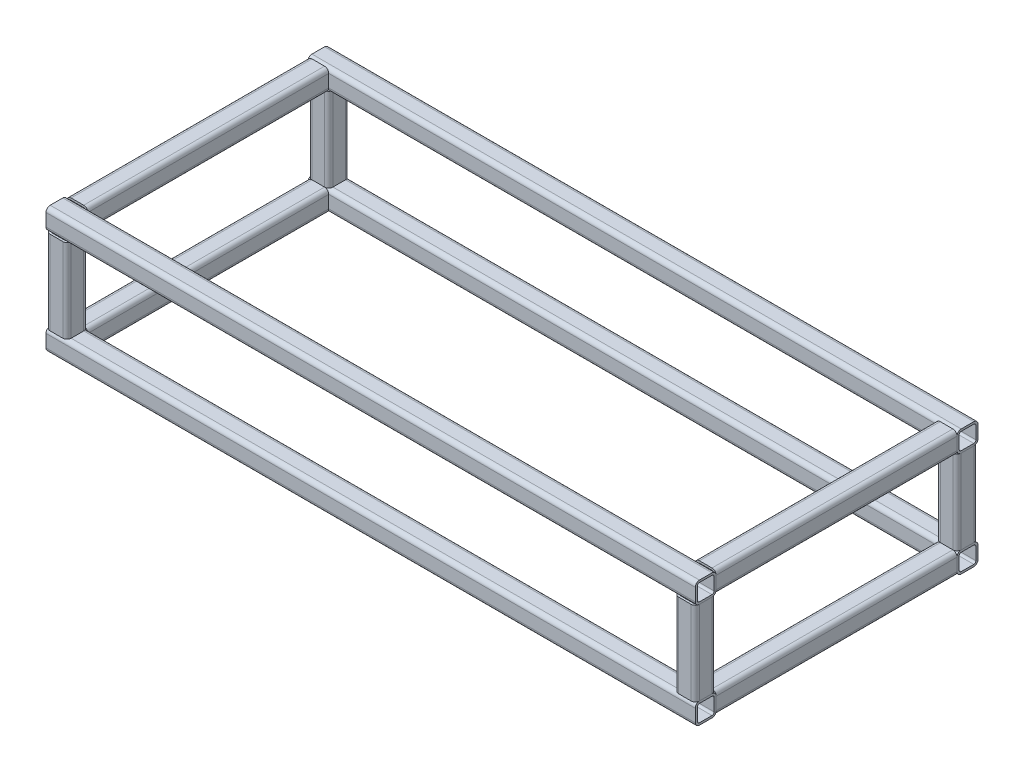
from build123d import *

# Parameters (mm, degrees)
SQUARE_START                                 = 10
SQUARE_TUBE_CONFIGURED_20_X_20_X_2_1_DEPTH   = 230
SQUARE_TUBE_CONFIGURED_20_X_20_X_2_1_2_DEPTH = 80
SQUARE_TUBE_CONFIGURED_20_X_20_X_2_1_3_DEPTH = 230
SQUARE_TUBE_CONFIGURED_20_X_20_X_2_1_4_DEPTH = 80
SQUARE_TUBE_CONFIGURED_20_X_20_X_2_1_5_DEPTH = 80
SQUARE_TUBE_CONFIGURED_20_X_20_X_2_1_6_DEPTH = 80
SQUARE_TUBE_CONFIGURED_20_X_20_X_2_1_7_DEPTH = 230
SQUARE_TUBE_CONFIGURED_20_X_20_X_2_1_8_DEPTH = 230
SQUARE_TUBE_CONFIGURED_20_X_20_X_2_1_9_DEPTH = 600
SQUARE_TUBE_CONFIGURED_20_X_20_X_2_1_1_DEPTH = 600
SQUARE_TUBE_CONFIGURED_20_X_20_X_2_11_DEPTH  = 600
SQUARE_TUBE_CONFIGURED_20_X_20_X_2_13_DEPTH  = 600
WELD_TRIM_1_EXTEND_1_RUN_ON                  = 10
WELD_TRIM_1_EXTEND_1_OTHER_END_RUN_ON        = 10
WELD_TRIM_1_EXTEND_2_RUN_ON                  = 10
WELD_TRIM_1_EXTEND_2_OTHER_END_RUN_ON        = 10
WELD_TRIM_1_EXTEND_3_RUN_ON                  = 10
WELD_TRIM_1_EXTEND_3_OTHER_END_RUN_ON        = 10
WELD_TRIM_1_EXTEND_4_RUN_ON                  = 10
WELD_TRIM_1_EXTEND_4_OTHER_END_RUN_ON        = 10


with BuildPart() as part:
    # Square tube - configured 20 X 20 X 2(1): read off the stored shape, not the designer's step
    # Square tube - configured 20 X 20 X 2(1) o → Square tube - configured 20 X 20 X 2(1) (new body)
    with BuildSketch(Plane.XY.offset(SQUARE_START)):
        with BuildLine():
            Line((10, -6), (10, 6))
            ThreePointArc((10, 6), (8.828427125, 8.828427125), (6, 10))
            Line((6, 10), (-6, 10))
            ThreePointArc((-6, 10), (-8.828427125, 8.828427125), (-10, 6))
            Line((-10, 6), (-10, -6))
            ThreePointArc((-10, -6), (-8.828427125, -8.828427125), (-6, -10))
            Line((-6, -10), (6, -10))
            ThreePointArc((6, -10), (8.828427125, -8.828427125), (10, -6))
        make_face()
        with BuildLine():
            ThreePointArc((-6, -8), (-7.414213562, -7.414213562), (-8, -6))
            Line((-8, -6), (-8, 6))
            ThreePointArc((-8, 6), (-7.414213562, 7.414213562), (-6, 8))
            Line((-6, 8), (6, 8))
            ThreePointArc((6, 8), (7.414213562, 7.414213562), (8, 6))
            Line((8, 6), (8, -6))
            ThreePointArc((8, -6), (7.414213562, -7.414213562), (6, -8))
            Line((6, -8), (-6, -8))
        make_face(mode=Mode.SUBTRACT)
    extrude(amount=SQUARE_TUBE_CONFIGURED_20_X_20_X_2_1_DEPTH)


with BuildPart() as body_2:
    # Square tube - configured 20 X 20 X 2 2 → Square tube - configured 20 X 20 X 2_1 2 (new body)
    with BuildSketch(Plane(origin=(0, 0, 0), x_dir=(1, 0, 0), z_dir=(0, 1, 0)).offset(SQUARE_START)):
        with BuildLine():
            Line((10, -256), (10, -244))
            ThreePointArc((10, -244), (8.828427125, -241.171572875), (6, -240))
            Line((6, -240), (-6, -240))
            ThreePointArc((-6, -240), (-8.828427125, -241.171572875), (-10, -244))
            Line((-10, -244), (-10, -256))
            ThreePointArc((-10, -256), (-8.828427125, -258.828427125), (-6, -260))
            Line((-6, -260), (6, -260))
            ThreePointArc((6, -260), (8.828427125, -258.828427125), (10, -256))
        make_face()
        with BuildLine():
            ThreePointArc((-6, -258), (-7.414213562, -257.414213562), (-8, -256))
            Line((-8, -256), (-8, -244))
            ThreePointArc((-8, -244), (-7.414213562, -242.585786438), (-6, -242))
            Line((-6, -242), (6, -242))
            ThreePointArc((6, -242), (7.414213562, -242.585786438), (8, -244))
            Line((8, -244), (8, -256))
            ThreePointArc((8, -256), (7.414213562, -257.414213562), (6, -258))
            Line((6, -258), (-6, -258))
        make_face(mode=Mode.SUBTRACT)
    extrude(amount=SQUARE_TUBE_CONFIGURED_20_X_20_X_2_1_2_DEPTH)


with BuildPart() as body_3:
    # Square tube - configured 20 X 20 X 2 3 → Square tube - configured 20 X 20 X 2_1 3 (new body)
    with BuildSketch(Plane.XY.offset(SQUARE_START)):
        with BuildLine():
            Line((610, -6), (610, 6))
            ThreePointArc((610, 6), (608.828427125, 8.828427125), (606, 10))
            Line((606, 10), (594, 10))
            ThreePointArc((594, 10), (591.171572875, 8.828427125), (590, 6))
            Line((590, 6), (590, -6))
            ThreePointArc((590, -6), (591.171572875, -8.828427125), (594, -10))
            Line((594, -10), (606, -10))
            ThreePointArc((606, -10), (608.828427125, -8.828427125), (610, -6))
        make_face()
        with BuildLine():
            ThreePointArc((594, -8), (592.585786438, -7.414213562), (592, -6))
            Line((592, -6), (592, 6))
            ThreePointArc((592, 6), (592.585786438, 7.414213562), (594, 8))
            Line((594, 8), (606, 8))
            ThreePointArc((606, 8), (607.414213562, 7.414213562), (608, 6))
            Line((608, 6), (608, -6))
            ThreePointArc((608, -6), (607.414213562, -7.414213562), (606, -8))
            Line((606, -8), (594, -8))
        make_face(mode=Mode.SUBTRACT)
    extrude(amount=SQUARE_TUBE_CONFIGURED_20_X_20_X_2_1_3_DEPTH)


with BuildPart() as body_4:
    # Square tube - configured 20 X 20 X 2 4 → Square tube - configured 20 X 20 X 2_1 4 (new body)
    with BuildSketch(Plane(origin=(0, 0, 0), x_dir=(1, 0, 0), z_dir=(0, 1, 0)).offset(SQUARE_START)):
        with BuildLine():
            Line((610, -256), (610, -244))
            ThreePointArc((610, -244), (608.828427125, -241.171572875), (606, -240))
            Line((606, -240), (594, -240))
            ThreePointArc((594, -240), (591.171572875, -241.171572875), (590, -244))
            Line((590, -244), (590, -256))
            ThreePointArc((590, -256), (591.171572875, -258.828427125), (594, -260))
            Line((594, -260), (606, -260))
            ThreePointArc((606, -260), (608.828427125, -258.828427125), (610, -256))
        make_face()
        with BuildLine():
            ThreePointArc((594, -258), (592.585786438, -257.414213562), (592, -256))
            Line((592, -256), (592, -244))
            ThreePointArc((592, -244), (592.585786438, -242.585786438), (594, -242))
            Line((594, -242), (606, -242))
            ThreePointArc((606, -242), (607.414213562, -242.585786438), (608, -244))
            Line((608, -244), (608, -256))
            ThreePointArc((608, -256), (607.414213562, -257.414213562), (606, -258))
            Line((606, -258), (594, -258))
        make_face(mode=Mode.SUBTRACT)
    extrude(amount=SQUARE_TUBE_CONFIGURED_20_X_20_X_2_1_4_DEPTH)


with BuildPart() as body_5:
    # Square tube - configured 20 X 20 X 2 5 → Square tube - configured 20 X 20 X 2_1 5 (new body)
    with BuildSketch(Plane(origin=(0, 0, 0), x_dir=(1, 0, 0), z_dir=(0, 1, 0)).offset(SQUARE_START)):
        with BuildLine():
            Line((10, -6), (10, 6))
            ThreePointArc((10, 6), (8.828427125, 8.828427125), (6, 10))
            Line((6, 10), (-6, 10))
            ThreePointArc((-6, 10), (-8.828427125, 8.828427125), (-10, 6))
            Line((-10, 6), (-10, -6))
            ThreePointArc((-10, -6), (-8.828427125, -8.828427125), (-6, -10))
            Line((-6, -10), (6, -10))
            ThreePointArc((6, -10), (8.828427125, -8.828427125), (10, -6))
        make_face()
        with BuildLine():
            ThreePointArc((-6, -8), (-7.414213562, -7.414213562), (-8, -6))
            Line((-8, -6), (-8, 6))
            ThreePointArc((-8, 6), (-7.414213562, 7.414213562), (-6, 8))
            Line((-6, 8), (6, 8))
            ThreePointArc((6, 8), (7.414213562, 7.414213562), (8, 6))
            Line((8, 6), (8, -6))
            ThreePointArc((8, -6), (7.414213562, -7.414213562), (6, -8))
            Line((6, -8), (-6, -8))
        make_face(mode=Mode.SUBTRACT)
    extrude(amount=SQUARE_TUBE_CONFIGURED_20_X_20_X_2_1_5_DEPTH)


with BuildPart() as body_6:
    # Square tube - configured 20 X 20 X 2 6 → Square tube - configured 20 X 20 X 2_1 6 (new body)
    with BuildSketch(Plane(origin=(0, 0, 0), x_dir=(1, 0, 0), z_dir=(0, 1, 0)).offset(SQUARE_START)):
        with BuildLine():
            Line((610, -6), (610, 6))
            ThreePointArc((610, 6), (608.828427125, 8.828427125), (606, 10))
            Line((606, 10), (594, 10))
            ThreePointArc((594, 10), (591.171572875, 8.828427125), (590, 6))
            Line((590, 6), (590, -6))
            ThreePointArc((590, -6), (591.171572875, -8.828427125), (594, -10))
            Line((594, -10), (606, -10))
            ThreePointArc((606, -10), (608.828427125, -8.828427125), (610, -6))
        make_face()
        with BuildLine():
            ThreePointArc((594, -8), (592.585786438, -7.414213562), (592, -6))
            Line((592, -6), (592, 6))
            ThreePointArc((592, 6), (592.585786438, 7.414213562), (594, 8))
            Line((594, 8), (606, 8))
            ThreePointArc((606, 8), (607.414213562, 7.414213562), (608, 6))
            Line((608, 6), (608, -6))
            ThreePointArc((608, -6), (607.414213562, -7.414213562), (606, -8))
            Line((606, -8), (594, -8))
        make_face(mode=Mode.SUBTRACT)
    extrude(amount=SQUARE_TUBE_CONFIGURED_20_X_20_X_2_1_6_DEPTH)


with BuildPart() as body_7:
    # Square tube - configured 20 X 20 X 2 7 → Square tube - configured 20 X 20 X 2_1 7 (new body)
    with BuildSketch(Plane.XY.offset(SQUARE_START)):
        with BuildLine():
            Line((610, 94), (610, 106))
            ThreePointArc((610, 106), (608.828427125, 108.828427125), (606, 110))
            Line((606, 110), (594, 110))
            ThreePointArc((594, 110), (591.171572875, 108.828427125), (590, 106))
            Line((590, 106), (590, 94))
            ThreePointArc((590, 94), (591.171572875, 91.171572875), (594, 90))
            Line((594, 90), (606, 90))
            ThreePointArc((606, 90), (608.828427125, 91.171572875), (610, 94))
        make_face()
        with BuildLine():
            ThreePointArc((594, 92), (592.585786438, 92.585786438), (592, 94))
            Line((592, 94), (592, 106))
            ThreePointArc((592, 106), (592.585786438, 107.414213562), (594, 108))
            Line((594, 108), (606, 108))
            ThreePointArc((606, 108), (607.414213562, 107.414213562), (608, 106))
            Line((608, 106), (608, 94))
            ThreePointArc((608, 94), (607.414213562, 92.585786438), (606, 92))
            Line((606, 92), (594, 92))
        make_face(mode=Mode.SUBTRACT)
    extrude(amount=SQUARE_TUBE_CONFIGURED_20_X_20_X_2_1_7_DEPTH)


with BuildPart() as body_8:
    # Square tube - configured 20 X 20 X 2 8 → Square tube - configured 20 X 20 X 2_1 8 (new body)
    with BuildSketch(Plane.XY.offset(SQUARE_START)):
        with BuildLine():
            Line((10, 94), (10, 106))
            ThreePointArc((10, 106), (8.828427125, 108.828427125), (6, 110))
            Line((6, 110), (-6, 110))
            ThreePointArc((-6, 110), (-8.828427125, 108.828427125), (-10, 106))
            Line((-10, 106), (-10, 94))
            ThreePointArc((-10, 94), (-8.828427125, 91.171572875), (-6, 90))
            Line((-6, 90), (6, 90))
            ThreePointArc((6, 90), (8.828427125, 91.171572875), (10, 94))
        make_face()
        with BuildLine():
            ThreePointArc((-6, 92), (-7.414213562, 92.585786438), (-8, 94))
            Line((-8, 94), (-8, 106))
            ThreePointArc((-8, 106), (-7.414213562, 107.414213562), (-6, 108))
            Line((-6, 108), (6, 108))
            ThreePointArc((6, 108), (7.414213562, 107.414213562), (8, 106))
            Line((8, 106), (8, 94))
            ThreePointArc((8, 94), (7.414213562, 92.585786438), (6, 92))
            Line((6, 92), (-6, 92))
        make_face(mode=Mode.SUBTRACT)
    extrude(amount=SQUARE_TUBE_CONFIGURED_20_X_20_X_2_1_8_DEPTH)


with BuildPart() as body_9:
    # Square tube - configured 20 X 20 X 2 9 → Square tube - configured 20 X 20 X 2_1 9 (new body)
    with BuildSketch(Plane.YZ):
        with BuildLine():
            ThreePointArc((6, 240), (8.828427125, 241.171572875), (10, 244))
            Line((10, 244), (10, 256))
            ThreePointArc((10, 256), (8.828427125, 258.828427125), (6, 260))
            Line((6, 260), (-6, 260))
            ThreePointArc((-6, 260), (-8.828427125, 258.828427125), (-10, 256))
            Line((-10, 256), (-10, 244))
            ThreePointArc((-10, 244), (-8.828427125, 241.171572875), (-6, 240))
            Line((-6, 240), (6, 240))
        make_face()
        with BuildLine():
            Line((-6, 258), (6, 258))
            ThreePointArc((6, 258), (7.414213562, 257.414213562), (8, 256))
            Line((8, 256), (8, 244))
            ThreePointArc((8, 244), (7.414213562, 242.585786438), (6, 242))
            Line((6, 242), (-6, 242))
            ThreePointArc((-6, 242), (-7.414213562, 242.585786438), (-8, 244))
            Line((-8, 244), (-8, 256))
            ThreePointArc((-8, 256), (-7.414213562, 257.414213562), (-6, 258))
        make_face(mode=Mode.SUBTRACT)
    extrude(amount=SQUARE_TUBE_CONFIGURED_20_X_20_X_2_1_9_DEPTH)

    # Weld Trim 1 extend 4: the member runs on so that the trim can cut it back to the boundary (SolidWorks' 'allow extension')
    extrude(body_9.faces().sort_by_distance((600, -8, 242))[0], amount=WELD_TRIM_1_EXTEND_4_RUN_ON, dir=(1, 0, 0))

    # Weld Trim 1 extend 4 other end: the member runs on so that the trim can cut it back to the boundary (SolidWorks' 'allow extension')
    extrude(body_9.faces().sort_by_distance((0, -8, 242))[0], amount=WELD_TRIM_1_EXTEND_4_OTHER_END_RUN_ON, dir=(-1, 0, 0))


with BuildPart() as body_10:
    # Square tube - configured 20 X 20 X 2 10 → Square tube - configured 20 X 20 X 2_1 1 (new body)
    with BuildSketch(Plane.YZ):
        with BuildLine():
            ThreePointArc((6, -10), (8.828427125, -8.828427125), (10, -6))
            Line((10, -6), (10, 6))
            ThreePointArc((10, 6), (8.828427125, 8.828427125), (6, 10))
            Line((6, 10), (-6, 10))
            ThreePointArc((-6, 10), (-8.828427125, 8.828427125), (-10, 6))
            Line((-10, 6), (-10, -6))
            ThreePointArc((-10, -6), (-8.828427125, -8.828427125), (-6, -10))
            Line((-6, -10), (6, -10))
        make_face()
        with BuildLine():
            Line((-6, 8), (6, 8))
            ThreePointArc((6, 8), (7.414213562, 7.414213562), (8, 6))
            Line((8, 6), (8, -6))
            ThreePointArc((8, -6), (7.414213562, -7.414213562), (6, -8))
            Line((6, -8), (-6, -8))
            ThreePointArc((-6, -8), (-7.414213562, -7.414213562), (-8, -6))
            Line((-8, -6), (-8, 6))
            ThreePointArc((-8, 6), (-7.414213562, 7.414213562), (-6, 8))
        make_face(mode=Mode.SUBTRACT)
    extrude(amount=SQUARE_TUBE_CONFIGURED_20_X_20_X_2_1_1_DEPTH)

    # Weld Trim 1 extend 3: the member runs on so that the trim can cut it back to the boundary (SolidWorks' 'allow extension')
    extrude(body_10.faces().sort_by_distance((600, -8, -8))[0], amount=WELD_TRIM_1_EXTEND_3_RUN_ON, dir=(1, 0, 0))

    # Weld Trim 1 extend 3 other end: the member runs on so that the trim can cut it back to the boundary (SolidWorks' 'allow extension')
    extrude(body_10.faces().sort_by_distance((0, -8, -8))[0], amount=WELD_TRIM_1_EXTEND_3_OTHER_END_RUN_ON, dir=(-1, 0, 0))


with BuildPart() as body_11:
    # Square tube - configured 20 X 20 X 2 12 → Square tube - configured 20 X 20 X 2 11 (new body)
    with BuildSketch(Plane.YZ):
        with BuildLine():
            ThreePointArc((106, -10), (108.828427125, -8.828427125), (110, -6))
            Line((110, -6), (110, 6))
            ThreePointArc((110, 6), (108.828427125, 8.828427125), (106, 10))
            Line((106, 10), (94, 10))
            ThreePointArc((94, 10), (91.171572875, 8.828427125), (90, 6))
            Line((90, 6), (90, -6))
            ThreePointArc((90, -6), (91.171572875, -8.828427125), (94, -10))
            Line((94, -10), (106, -10))
        make_face()
        with BuildLine():
            Line((94, 8), (106, 8))
            ThreePointArc((106, 8), (107.414213562, 7.414213562), (108, 6))
            Line((108, 6), (108, -6))
            ThreePointArc((108, -6), (107.414213562, -7.414213562), (106, -8))
            Line((106, -8), (94, -8))
            ThreePointArc((94, -8), (92.585786438, -7.414213562), (92, -6))
            Line((92, -6), (92, 6))
            ThreePointArc((92, 6), (92.585786438, 7.414213562), (94, 8))
        make_face(mode=Mode.SUBTRACT)
    extrude(amount=SQUARE_TUBE_CONFIGURED_20_X_20_X_2_11_DEPTH)

    # Weld Trim 1 extend 2: the member runs on so that the trim can cut it back to the boundary (SolidWorks' 'allow extension')
    extrude(body_11.faces().sort_by_distance((600, 92, -8))[0], amount=WELD_TRIM_1_EXTEND_2_RUN_ON, dir=(1, 0, 0))

    # Weld Trim 1 extend 2 other end: the member runs on so that the trim can cut it back to the boundary (SolidWorks' 'allow extension')
    extrude(body_11.faces().sort_by_distance((0, 92, -8))[0], amount=WELD_TRIM_1_EXTEND_2_OTHER_END_RUN_ON, dir=(-1, 0, 0))


with BuildPart() as body_12:
    # Square tube - configured 20 X 20 X 2 14 → Square tube - configured 20 X 20 X 2 13 (new body)
    with BuildSketch(Plane.YZ):
        with BuildLine():
            ThreePointArc((106, 240), (108.828427125, 241.171572875), (110, 244))
            Line((110, 244), (110, 256))
            ThreePointArc((110, 256), (108.828427125, 258.828427125), (106, 260))
            Line((106, 260), (94, 260))
            ThreePointArc((94, 260), (91.171572875, 258.828427125), (90, 256))
            Line((90, 256), (90, 244))
            ThreePointArc((90, 244), (91.171572875, 241.171572875), (94, 240))
            Line((94, 240), (106, 240))
        make_face()
        with BuildLine():
            Line((94, 258), (106, 258))
            ThreePointArc((106, 258), (107.414213562, 257.414213562), (108, 256))
            Line((108, 256), (108, 244))
            ThreePointArc((108, 244), (107.414213562, 242.585786438), (106, 242))
            Line((106, 242), (94, 242))
            ThreePointArc((94, 242), (92.585786438, 242.585786438), (92, 244))
            Line((92, 244), (92, 256))
            ThreePointArc((92, 256), (92.585786438, 257.414213562), (94, 258))
        make_face(mode=Mode.SUBTRACT)
    extrude(amount=SQUARE_TUBE_CONFIGURED_20_X_20_X_2_13_DEPTH)

    # Weld Trim 1 extend 1: the member runs on so that the trim can cut it back to the boundary (SolidWorks' 'allow extension')
    extrude(body_12.faces().sort_by_distance((600, 92, 242))[0], amount=WELD_TRIM_1_EXTEND_1_RUN_ON, dir=(1, 0, 0))

    # Weld Trim 1 extend 1 other end: the member runs on so that the trim can cut it back to the boundary (SolidWorks' 'allow extension')
    extrude(body_12.faces().sort_by_distance((0, 92, 242))[0], amount=WELD_TRIM_1_EXTEND_1_OTHER_END_RUN_ON, dir=(-1, 0, 0))


solid = Compound([part.part, body_2.part, body_3.part, body_4.part, body_5.part, body_6.part, body_7.part, body_8.part, body_9.part, body_10.part, body_11.part, body_12.part])
